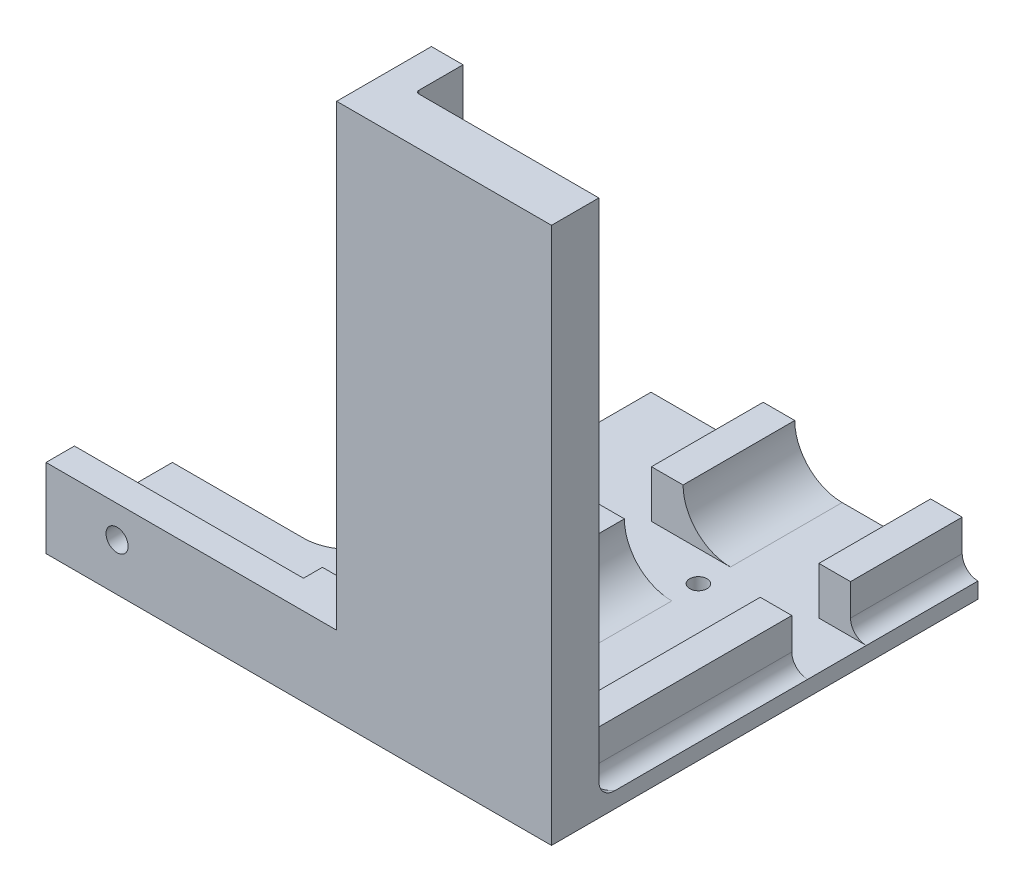
from build123d import *

# Parameters (mm, degrees)
BOSS_EXTRUDE1_DEPTH      = 250
BOSS_EXTRUDE2_DEPTH      = 50
BOSS_EXTRUDE2_2_DEPTH    = 50
LPATTERN1_COUNT          = 4
LPATTERN1_PITCH          = 60
SKETCH2_R                = 2.75
CUT_EXTRUDE1_DEPTH       = 251.864711302
UPPER_ACRYLIC_SUPP_W     = 20
UPPER_ACRYLIC_SUPP_H     = 250
BOSS_EXTRUDE3_DEPTH      = 5
UPPER_ACRYLIC_SUPP_3_W   = 10
UPPER_ACRYLIC_SUPP_3_H   = 66.073604859
UPPER_ACRYLIC_SUPP_3_H_2 = 41.475217291
UPPER_ACRYLIC_SUPP_3_H_3 = 42.557179481
UPPER_ACRYLIC_SUPP_3_H_4 = 45.558340935
BOSS_EXTRUDE4_DEPTH      = 15
FILLET1_R                = 15
SKETCH4_W                = 60
SKETCH4_H                = 15
BOSS_EXTRUDE5_DEPTH      = 5
SKETCH4_3_W              = 60
SKETCH4_3_H              = 15
BOSS_EXTRUDE6_DEPTH      = 60
SKETCH5_W                = 10
SKETCH5_H                = 45
BOSS_EXTRUDE7_DEPTH      = 15
BOSS_EXTRUDE8_START      = 250
SKETCH5_3_W              = 10
SKETCH5_3_H              = 45
BOSS_EXTRUDE8_DEPTH      = 15
FILLET2_R                = 1
SKETCH6_W                = 6
SKETCH6_H                = 60
CUT_EXTRUDE2_DEPTH       = 6
BOSS_EXTRUDE9_DEPTH      = 30
SKETCH8_W                = 333.602701612
SKETCH8_H                = 59.031331047
CUT_EXTRUDE3_DEPTH       = 150
SKETCH9_W                = 6
SKETCH9_H                = 20
CLOTH_ESCAPE_GAP_DEPTH   = 20
SKETCH11_W               = 9
SKETCH11_H               = 20
BOSS_EXTRUDE11_DEPTH     = 100
CUT_EXTRUDE4_DEPTH       = 68
SKETCH13_W               = 40
SKETCH13_H               = 5
BOSS_EXTRUDE13_DEPTH     = 100
CUT_EXTRUDE5_DEPTH       = 100
FILLET3_R                = 15
BOSS_EXTRUDE14_START     = -5
BOSS_EXTRUDE14_DEPTH     = 25
CUT_EXTRUDE6_DEPTH       = 30
CUT_EXTRUDE6_DEPTH_BACK  = 10
SKETCH16_5_W             = 8.5
SKETCH16_5_H             = 41.475217291
SKETCH16_5_H_2           = 42.557179481
SKETCH16_5_W_2           = 1.5
SKETCH16_5_H_3           = 42.177819043
SKETCH16_5_H_4           = 20.831100018
SKETCH16_5_H_5           = 17.311395043
SKETCH16_5_H_6           = 18.573684265
SKETCH16_5_H_7           = 65.073604859
SKETCH16_6_W             = 8.5
SKETCH16_6_H             = 41.475217291
SKETCH16_6_H_2           = 42.557179481
SKETCH16_6_W_2           = 1.5
SKETCH16_6_H_3           = 42.177819043
SKETCH16_6_H_4           = 20.831100018
SKETCH16_6_H_5           = 17.311395043
SKETCH16_6_H_6           = 18.573684265
SKETCH16_6_H_7           = 65.073604859
BOSS_EXTRUDE15_DEPTH     = 5
BOSS_EXTRUDE16_DEPTH     = 20
SKETCH16_8_W             = 8.5
SKETCH16_8_H             = 41.475217291
SKETCH16_8_H_2           = 42.557179481
SKETCH16_8_W_2           = 1.5
SKETCH16_8_H_3           = 42.177819043
SKETCH16_8_H_4           = 65.073604859
BOSS_EXTRUDE17_DEPTH     = 15
BOSS_EXTRUDE18_START     = -5
BOSS_EXTRUDE18_DEPTH     = 25
FILLET4_R                = 5
BOSS_EXTRUDE21_START     = 145
BOSS_EXTRUDE21_DEPTH     = 170
SKETCH19_R               = 3.5
CUT_EXTRUDE7_DEPTH       = 10
CUT_EXTRUDE8_DEPTH       = 355
CUT_EXTRUDE8_DEPTH_BACK  = 10
SKETCH20_R               = 3.5
SKETCH21_W               = 15
SKETCH21_H               = 197.501027769
CUT_EXTRUDE9_DEPTH       = 130
SKETCH22_W               = 160
SKETCH22_H               = 135
SKETCH22_H_2             = 10
CUT_EXTRUDE11_DEPTH      = 270


with BuildPart() as part:
    # profile → Boss-Extrude1 (new body)
    with BuildSketch(Plane.XY):
        Polygon((-14.746446609, 10.353553391), (-5.253553391, 10.353553391), (5.667330529, 10.353553391), (14.746446609, 10.353553391), (20, 10.353553391), (20, 15.353553391), (-20, 15.353553391), (-20, 10.353553391), align=None)
    extrude(amount=BOSS_EXTRUDE1_DEPTH)

    # Sketch2 → Cut-Extrude1 (cut, through all)
    with BuildSketch(Plane.XZ.offset(-10.353553391)):
        with Locations(Location((-10, 175, 0), (0, 0, 270))):
            Circle(SKETCH2_R)
        with Locations(Location((10, 175, 0), (0, 0, 270))):
            Circle(SKETCH2_R)
        with Locations(Location((-10, 115, 0), (0, 0, 270))):
            Circle(SKETCH2_R)
        with Locations(Location((10, 115, 0), (0, 0, 270))):
            Circle(SKETCH2_R)
        with Locations(Location((-10, 55, 0), (0, 0, 270))):
            Circle(SKETCH2_R)
        with Locations(Location((10, 55, 0), (0, 0, 270))):
            Circle(SKETCH2_R)
    extrude(amount=-CUT_EXTRUDE1_DEPTH, mode=Mode.SUBTRACT)

    # upper_acrylic_supp → Boss-Extrude3 (add)
    with BuildSketch(Plane(origin=(0, 15.353553391, 0), x_dir=(1, 0, 0), z_dir=(0, 1, 0))):
        with Locations((-30, -125)):
            Rectangle(UPPER_ACRYLIC_SUPP_W, UPPER_ACRYLIC_SUPP_H)
    extrude(amount=-BOSS_EXTRUDE3_DEPTH)

    # upper_acrylic_supp<3> → Boss-Extrude4 (add)
    with BuildSketch(Plane(origin=(0, 15.353553391, 0), x_dir=(1, 0, 0), z_dir=(0, 1, 0))):
        with Locations((-29.5, -216.963197571)):
            Rectangle(UPPER_ACRYLIC_SUPP_3_W, UPPER_ACRYLIC_SUPP_3_H)
        with Locations((-29.5, -144.615102231)):
            Rectangle(UPPER_ACRYLIC_SUPP_3_W, UPPER_ACRYLIC_SUPP_3_H_2)
        with Locations((-29.5, -85.287508801)):
            Rectangle(UPPER_ACRYLIC_SUPP_3_W, UPPER_ACRYLIC_SUPP_3_H_3)
        with Locations((-29.5, -22.779170468)):
            Rectangle(UPPER_ACRYLIC_SUPP_3_W, UPPER_ACRYLIC_SUPP_3_H_4)
    extrude(amount=BOSS_EXTRUDE4_DEPTH)

    # Fillet1
    fillet1_edges = [part.edges().sort_by_distance(p)[0] for p in [
        (-24.5, 15.353553391, 22.779170467),
        (-24.5, 15.353553391, 85.287508801),
        (-24.5, 15.353553391, 144.615102231),
        (-24.5, 15.353553391, 216.963197571),
    ]]
    fillet(fillet1_edges, radius=FILLET1_R - 0.0001)  # a hair under: the kernel refuses the full size



with BuildPart() as body_2:
    # Sketch1<3> → Boss-Extrude2 (new body)
    with BuildSketch(Plane.XY):
        Polygon((-7.253553391, 8.353553391), (-8.119669914, 7.487436867), (-5.5, 7.487436867), (-4.987436867, 7.487436867), (-5.5, 6.974873734), (-7.874873734, 4.6), (-12.125126266, 4.6), (-14.5, 6.974873734), (-15.012563133, 7.487436867), (-14.5, 7.487436867), (-11.880330086, 7.487436867), (-12.746446609, 8.353553391), (-14.746446609, 10.353553391), (-5.253553391, 10.353553391), align=None)
    boss_extrude2 = extrude(amount=BOSS_EXTRUDE2_DEPTH)


with BuildPart() as body_3:
    # Sketch1<3> → Boss-Extrude2 2 (new body)
    with BuildSketch(Plane.XY):
        Polygon((12.746446609, 8.353553391), (11.880330086, 7.487436867), (14.5, 7.487436867), (15.012563133, 7.487436867), (14.5, 6.974873734), (12.125126266, 4.6), (7.874873734, 4.6), (5.5, 6.974873734), (4.987436867, 7.487436867), (5.5, 7.487436867), (8.533447053, 7.487436867), (7.667330529, 8.353553391), (5.667330529, 10.353553391), (14.746446609, 10.353553391), align=None)
    boss_extrude2_2 = extrude(amount=BOSS_EXTRUDE2_2_DEPTH)


with BuildPart() as lpattern1_1:
    # LPattern1: pattern copy
    add(boss_extrude2.moved(Location(Vector(0, 0, 1) * (1 * LPATTERN1_PITCH))))


with BuildPart() as lpattern1_2:
    # LPattern1: pattern copy
    add(boss_extrude2.moved(Location(Vector(0, 0, 1) * (2 * LPATTERN1_PITCH))))


with BuildPart() as lpattern1_3:
    # LPattern1: pattern copy
    add(boss_extrude2.moved(Location(Vector(0, 0, 1) * (3 * LPATTERN1_PITCH))))


with BuildPart() as lpattern1_4:
    # LPattern1: pattern copy
    add(boss_extrude2_2.moved(Location(Vector(0, 0, 1) * (1 * LPATTERN1_PITCH))))


with BuildPart() as lpattern1_5:
    # LPattern1: pattern copy
    add(boss_extrude2_2.moved(Location(Vector(0, 0, 1) * (2 * LPATTERN1_PITCH))))


with BuildPart() as lpattern1_6:
    # LPattern1: pattern copy
    add(boss_extrude2_2.moved(Location(Vector(0, 0, 1) * (3 * LPATTERN1_PITCH))))


with BuildPart() as part_1:
    add(part.part)

    add(body_2.part)  # Boss-Extrude5 merges body 2

    add(body_3.part)  # Boss-Extrude5 merges body 3
    # Sketch4 → Boss-Extrude5 (add, symmetric)
    with BuildSketch(Plane(origin=(0, 15.353553391, 0), x_dir=(1, 0, 0), z_dir=(0, 1, 0))):
        with Locations((-10, -257.5)):
            Rectangle(SKETCH4_W, SKETCH4_H)
        with Locations((-10, 7.5)):
            Rectangle(SKETCH4_W, SKETCH4_H)
    extrude(amount=BOSS_EXTRUDE5_DEPTH, both=True)

    # Sketch4<3> → Boss-Extrude6 (add)
    with BuildSketch(Plane(origin=(0, 15.353553391, 0), x_dir=(1, 0, 0), z_dir=(0, 1, 0))):
        with Locations((-10, -257.5)):
            Rectangle(SKETCH4_3_W, SKETCH4_3_H)
        with Locations((-10, 7.5)):
            Rectangle(SKETCH4_3_W, SKETCH4_3_H)
    extrude(amount=BOSS_EXTRUDE6_DEPTH)

    # Sketch5 → Boss-Extrude7 (add)
    with BuildSketch(Plane(origin=(0, 0, 250), x_dir=(-1, 0, 0), z_dir=(0, 0, -1))):
        with Locations((29.5, 52.853553391)):
            Rectangle(SKETCH5_W, SKETCH5_H)
    extrude(amount=BOSS_EXTRUDE7_DEPTH)

    # Sketch5<3> → Boss-Extrude8 (add)
    with BuildSketch(Plane(origin=(0, 0, 250), x_dir=(-1, 0, 0), z_dir=(0, 0, -1)).offset(BOSS_EXTRUDE8_START)):
        with Locations((29.5, 52.853553391)):
            Rectangle(SKETCH5_3_W, SKETCH5_3_H)
    extrude(amount=-BOSS_EXTRUDE8_DEPTH)

    # Fillet2
    fillet2_edges = [part_1.edges().sort_by_distance(p)[0] for p in [
        (-24.5, 52.853503391, 250),
        (-24.5, 52.853503391, 0),
        (5.24995, 15.353553391, 250),
        (-20.106631007, 19.746922384, 250),
        (-20.106631007, 19.746922384, 0),
        (5.24995, 15.353553391, 0),
    ]]
    fillet(fillet2_edges, radius=FILLET2_R)

    # Sketch6 → Cut-Extrude2 (cut)
    with BuildSketch(Plane.ZY.offset(40)):
        with Locations((253, 45.353553391)):
            Rectangle(SKETCH6_W, SKETCH6_H)
        with Locations((-3, 45.353553391)):
            Rectangle(SKETCH6_W, SKETCH6_H)
    extrude(amount=-CUT_EXTRUDE2_DEPTH, mode=Mode.SUBTRACT)

    # Sketch7 → Boss-Extrude9 (add)
    with BuildSketch(Plane.ZY.offset(40)):
        Polygon((265, 75.353553391), (256, 75.353553391), (256, 15.353553391), (-6, 15.353553391), (-6, 75.353553391), (-15, 75.353553391), (-15, 10.353553391), (265, 10.353553391), align=None)
    extrude(amount=BOSS_EXTRUDE9_DEPTH)

    # Sketch8 → Cut-Extrude3 (cut)
    with BuildSketch(Plane.ZY.offset(70)):
        with Locations((122.426839416, 64.869218915)):
            Rectangle(SKETCH8_W, SKETCH8_H)
    extrude(amount=-CUT_EXTRUDE3_DEPTH, mode=Mode.SUBTRACT)

    # Sketch9 → cloth_escape_gap (add)
    with BuildSketch(Plane.ZY.offset(34)):
        with Locations((253, 25.353553391)):
            Rectangle(SKETCH9_W, SKETCH9_H)
        with Locations((-3, 25.353553391)):
            Rectangle(SKETCH9_W, SKETCH9_H)
    extrude(amount=CLOTH_ESCAPE_GAP_DEPTH)

    # Sketch11 → Boss-Extrude11 (add)
    with BuildSketch(Plane.ZY.offset(70)):
        with Locations((-10.5, 25.353553391)):
            Rectangle(SKETCH11_W, SKETCH11_H)
        with Locations((260.5, 25.353553391)):
            Rectangle(SKETCH11_W, SKETCH11_H)
    extrude(amount=BOSS_EXTRUDE11_DEPTH)

    # Sketch12 → Cut-Extrude4 (cut)
    with BuildSketch(Plane.XZ.offset(-10.353553391)):
        Polygon((-170, 265), (-70, 265), (-170, 260.5), align=None)
        Polygon((-70, -15), (-170, -10.5), (-170, -15), align=None)
    extrude(amount=-CUT_EXTRUDE4_DEPTH, mode=Mode.SUBTRACT)

    # Sketch13 → Boss-Extrude13 (add)
    with BuildSketch(Plane.ZY.offset(70)):
        with Locations((5, 12.853553391)):
            Rectangle(SKETCH13_W, SKETCH13_H)
        with Locations((245, 12.853553391)):
            Rectangle(SKETCH13_W, SKETCH13_H)
    extrude(amount=BOSS_EXTRUDE13_DEPTH)

    # Sketch14 → Cut-Extrude5 (cut)
    with BuildSketch(Plane(origin=(0, 15.353553391, 0), x_dir=(1, 0, 0), z_dir=(0, 1, 0))):
        Polygon((-70, -265), (-170, -260.5), (-170, -265), align=None)
        Polygon((-170, 15), (-170, 10.5), (-70, 15), align=None)
    extrude(amount=-CUT_EXTRUDE5_DEPTH, mode=Mode.SUBTRACT)

    # Fillet3
    fillet3_edges = [part_1.edges().sort_by_distance(p)[0] for p in [
        (-70, 12.853553391, 25),
        (-70, 12.853553391, 225),
    ]]
    fillet(fillet3_edges, radius=FILLET3_R)

    # Sketch16 → Boss-Extrude14 (add)
    with BuildSketch(Plane(origin=(0, 15.353553391, 0), x_dir=(1, 0, 0), z_dir=(0, 1, 0)).offset(BOSS_EXTRUDE14_START)):
        Polygon((28.5, 0), (33.5, 0), (33.5, 15), (18.5, 15), (18.5, 0), align=None)
        Polygon((18.5, -250), (18.5, -265), (33.5, -265), (33.5, -250), (28.5, -250), align=None)
    extrude(amount=BOSS_EXTRUDE14_DEPTH)

    # Sketch16<5> → Cut-Extrude6 (cut, two sides: drawn at the far end of the back side and taken through both)
    with BuildSketch(Plane(origin=(0, 15.353553391, 0), x_dir=(1, 0, 0), z_dir=(0, 1, 0)).offset(-CUT_EXTRUDE6_DEPTH_BACK)):
        Polygon((18.5, -250), (18.5, -265), (33.5, -265), (33.5, -250), (28.5, -250), align=None)
        Polygon((28.5, -250), (33.5, -250), (33.5, 0), (28.5, 0), (28.5, -43.177819043), (20, -43.177819043), (20, -64.008919061), (28.5, -64.008919061), (28.5, -106.566098542), (20, -106.566098542), (20, -123.877493585), (28.5, -123.877493585), (28.5, -165.352710876), (20, -165.352710876), (20, -183.926395141), (28.5, -183.926395141), align=None)
        with Locations((24.25, -144.615102231)):
            Rectangle(SKETCH16_5_W, SKETCH16_5_H)
        with Locations((24.25, -85.287508801)):
            Rectangle(SKETCH16_5_W, SKETCH16_5_H_2)
        Polygon((28.5, -43.177819043), (28.5, 0), (18.5, 0), (18.5, -1), (20, -1), (20, -43.177819043), align=None)
        Polygon((28.5, 0), (33.5, 0), (33.5, 15), (18.5, 15), (18.5, 0), align=None)
        with Locations((19.25, -22.088909521)):
            Rectangle(SKETCH16_5_W_2, SKETCH16_5_H_3)
        with Locations((19.25, -53.593369052)):
            Rectangle(SKETCH16_5_W_2, SKETCH16_5_H_4)
        with Locations((19.25, -85.287508801)):
            Rectangle(SKETCH16_5_W_2, SKETCH16_5_H_2)
        with Locations((19.25, -115.221796064)):
            Rectangle(SKETCH16_5_W_2, SKETCH16_5_H_5)
        with Locations((19.25, -144.615102231)):
            Rectangle(SKETCH16_5_W_2, SKETCH16_5_H)
        with Locations((19.25, -174.639553009)):
            Rectangle(SKETCH16_5_W_2, SKETCH16_5_H_6)
        with Locations((19.25, -216.463197571)):
            Rectangle(SKETCH16_5_W_2, SKETCH16_5_H_7)
        Polygon((18.5, -249), (18.5, -250), (28.5, -250), (28.5, -183.926395141), (20, -183.926395141), (20, -249), align=None)
    extrude(amount=CUT_EXTRUDE6_DEPTH + CUT_EXTRUDE6_DEPTH_BACK, mode=Mode.SUBTRACT)

    # Sketch16<6> → Boss-Extrude15 (add)
    with BuildSketch(Plane(origin=(0, 15.353553391, 0), x_dir=(1, 0, 0), z_dir=(0, 1, 0))):
        Polygon((28.5, -250), (33.5, -250), (33.5, 0), (28.5, 0), (28.5, -43.177819043), (20, -43.177819043), (20, -64.008919061), (28.5, -64.008919061), (28.5, -106.566098542), (20, -106.566098542), (20, -123.877493585), (28.5, -123.877493585), (28.5, -165.352710876), (20, -165.352710876), (20, -183.926395141), (28.5, -183.926395141), align=None)
        Polygon((18.5, -249), (18.5, -250), (28.5, -250), (28.5, -183.926395141), (20, -183.926395141), (20, -249), align=None)
        Polygon((18.5, -250), (18.5, -265), (33.5, -265), (33.5, -250), (28.5, -250), align=None)
        with Locations((24.25, -144.615102231)):
            Rectangle(SKETCH16_6_W, SKETCH16_6_H)
        with Locations((24.25, -85.287508801)):
            Rectangle(SKETCH16_6_W, SKETCH16_6_H_2)
        Polygon((28.5, -43.177819043), (28.5, 0), (18.5, 0), (18.5, -1), (20, -1), (20, -43.177819043), align=None)
        Polygon((28.5, 0), (33.5, 0), (33.5, 15), (18.5, 15), (18.5, 0), align=None)
        with Locations((19.25, -22.088909521)):
            Rectangle(SKETCH16_6_W_2, SKETCH16_6_H_3)
        with Locations((19.25, -53.593369052)):
            Rectangle(SKETCH16_6_W_2, SKETCH16_6_H_4)
        with Locations((19.25, -85.287508801)):
            Rectangle(SKETCH16_6_W_2, SKETCH16_6_H_2)
        with Locations((19.25, -115.221796064)):
            Rectangle(SKETCH16_6_W_2, SKETCH16_6_H_5)
        with Locations((19.25, -144.615102231)):
            Rectangle(SKETCH16_6_W_2, SKETCH16_6_H)
        with Locations((19.25, -174.639553009)):
            Rectangle(SKETCH16_6_W_2, SKETCH16_6_H_6)
        with Locations((19.25, -216.463197571)):
            Rectangle(SKETCH16_6_W_2, SKETCH16_6_H_7)
    extrude(amount=-BOSS_EXTRUDE15_DEPTH)

    # Sketch16<7> → Boss-Extrude16 (add)
    with BuildSketch(Plane(origin=(0, 15.353553391, 0), x_dir=(1, 0, 0), z_dir=(0, 1, 0))):
        Polygon((18.5, -250), (18.5, -265), (33.5, -265), (33.5, -250), (28.5, -250), align=None)
        Polygon((28.5, 0), (33.5, 0), (33.5, 15), (18.5, 15), (18.5, 0), align=None)
    extrude(amount=BOSS_EXTRUDE16_DEPTH)

    # Sketch16<8> → Boss-Extrude17 (add)
    with BuildSketch(Plane(origin=(0, 15.353553391, 0), x_dir=(1, 0, 0), z_dir=(0, 1, 0))):
        Polygon((18.5, -249), (18.5, -250), (28.5, -250), (28.5, -183.926395141), (20, -183.926395141), (20, -249), align=None)
        with Locations((24.25, -144.615102231)):
            Rectangle(SKETCH16_8_W, SKETCH16_8_H)
        with Locations((24.25, -85.287508801)):
            Rectangle(SKETCH16_8_W, SKETCH16_8_H_2)
        Polygon((28.5, -43.177819043), (28.5, 0), (18.5, 0), (18.5, -1), (20, -1), (20, -43.177819043), align=None)
        with Locations((19.25, -22.088909521)):
            Rectangle(SKETCH16_8_W_2, SKETCH16_8_H_3)
        with Locations((19.25, -85.287508801)):
            Rectangle(SKETCH16_8_W_2, SKETCH16_8_H_2)
        with Locations((19.25, -144.615102231)):
            Rectangle(SKETCH16_8_W_2, SKETCH16_8_H)
        with Locations((19.25, -216.463197571)):
            Rectangle(SKETCH16_8_W_2, SKETCH16_8_H_4)
    extrude(amount=BOSS_EXTRUDE17_DEPTH)

    # Sketch14<2> → Boss-Extrude18 (add)
    with BuildSketch(Plane(origin=(0, 15.353553391, 0), x_dir=(1, 0, 0), z_dir=(0, 1, 0)).offset(BOSS_EXTRUDE18_START)):
        Polygon((-70, -265), (-170, -260.5), (-170, -265), align=None)
        Polygon((-170, 15), (-170, 10.5), (-70, 15), align=None)
    extrude(amount=BOSS_EXTRUDE18_DEPTH)

    # Fillet4
    fillet4_edges = [part_1.edges().sort_by_distance(p)[0] for p in [
        (31, 15.353553391, 0),
        (28.5, 15.353553391, 21.588909521),
        (28.5, 15.353553391, 85.287508801),
        (28.5, 15.353553391, 144.615102231),
        (31, 15.353553391, 250),
        (28.5, 15.353553391, 216.963197571),
    ]]
    fillet(fillet4_edges, radius=FILLET4_R - 0.0001)  # a hair under: the kernel refuses the full size

    # Sketch18 → Boss-Extrude21 (add)
    with BuildSketch(Plane(origin=(0, 35.353553391, 0), x_dir=(1, 0, 0), z_dir=(0, 1, 0)).offset(BOSS_EXTRUDE21_START)):
        with BuildLine():
            Line((-34.5, -250), (-34.5, -265))
            Line((-34.5, -265), (33.5, -265))
            Line((33.5, -265), (33.5, -250))
            Line((33.5, -250), (-23.5, -250))
            ThreePointArc((-23.5, -250), (-24.207106781, -249.707106781), (-24.5, -249))
            Line((-24.5, -249), (-24.5, -235))
            Line((-24.5, -235), (-34.5, -235))
            Line((-34.5, -235), (-34.5, -250))
        make_face()
        with BuildLine():
            Line((-34.5, 15), (-34.5, 0))
            Line((-34.5, 0), (-34.5, -15))
            Line((-34.5, -15), (-24.5, -15))
            Line((-24.5, -15), (-24.5, -1))
            ThreePointArc((-24.5, -1), (-24.207106781, -0.292893219), (-23.5, 0))
            Line((-23.5, 0), (33.5, 0))
            Line((33.5, 0), (33.5, 15))
            Line((33.5, 15), (-34.5, 15))
        make_face()
    extrude(amount=-BOSS_EXTRUDE21_DEPTH)

    # Sketch19 → Cut-Extrude7 (cut)
    with BuildSketch(Plane(origin=(0, 15.353553391, 0), x_dir=(1, 0, 0), z_dir=(0, 1, 0))):
        with Locations(Location((-154, -9.5, 0), (0, 0, 270))):
            Circle(SKETCH19_R)
        with Locations(Location((-104, -9.5, 0), (0, 0, 270))):
            Circle(SKETCH19_R)
        with Locations(Location((-104, -240.5, 0), (0, 0, 270))):
            Circle(SKETCH19_R)
        with Locations(Location((-154, -240.5, 0), (0, 0, 270))):
            Circle(SKETCH19_R)
    extrude(amount=-CUT_EXTRUDE7_DEPTH, mode=Mode.SUBTRACT)

    # Sketch20 → Cut-Extrude8 (cut, two sides: drawn at the far end of the back side and taken through both)
    with BuildSketch(Plane(origin=(0, 0, 256), x_dir=(-1, 0, 0), z_dir=(0, 0, -1)).offset(-CUT_EXTRUDE8_DEPTH_BACK)):
        with Locations(Location((104, 25.353553391, 0), (0, 0, 180))):
            Circle(SKETCH20_R)
        with Locations(Location((154, 25.353553391, 0), (0, 0, 180))):
            Circle(SKETCH20_R)
    extrude(amount=CUT_EXTRUDE8_DEPTH + CUT_EXTRUDE8_DEPTH_BACK, mode=Mode.SUBTRACT)

    # Sketch21 → Cut-Extrude9 (cut)
    with BuildSketch(Plane.XY):
        with Locations((6, 114.104067276)):
            Rectangle(SKETCH21_W, SKETCH21_H)
    extrude(amount=-CUT_EXTRUDE9_DEPTH, mode=Mode.SUBTRACT)


with BuildPart() as cut_extrude11_tool:
    # Sketch22 → Cut-Extrude11 (new body)
    with BuildSketch(Plane(origin=(0, 0, 0), x_dir=(1, 0, 0), z_dir=(0, 1, 0))):
        with Locations((-46.5, -52.5)):
            Rectangle(SKETCH22_W, SKETCH22_H)
        with Locations((-46.5, -125)):
            Rectangle(SKETCH22_W, SKETCH22_H_2)
        Polygon((-126.5, 15), (-186.5, 15), (-186.5, -265), (-126.5, -265), (-126.5, -130), (-126.5, -120), align=None)
    extrude(amount=CUT_EXTRUDE11_DEPTH)


with BuildPart() as part_2:
    add(part_1.part)

    # Cut-Extrude11: cut by cut_extrude11_tool
    add(cut_extrude11_tool.part, mode=Mode.SUBTRACT)


with BuildPart() as lpattern1_1_1:
    add(lpattern1_1.part)

    # Cut-Extrude11: cut by cut_extrude11_tool
    add(cut_extrude11_tool.part, mode=Mode.SUBTRACT)


with BuildPart() as lpattern1_2_1:
    add(lpattern1_2.part)

    # Cut-Extrude11: cut by cut_extrude11_tool
    add(cut_extrude11_tool.part, mode=Mode.SUBTRACT)


with BuildPart() as lpattern1_4_1:
    add(lpattern1_4.part)

    # Cut-Extrude11: cut by cut_extrude11_tool
    add(cut_extrude11_tool.part, mode=Mode.SUBTRACT)


with BuildPart() as lpattern1_5_1:
    add(lpattern1_5.part)

    # Cut-Extrude11: cut by cut_extrude11_tool
    add(cut_extrude11_tool.part, mode=Mode.SUBTRACT)


solid = Compound([lpattern1_3.part, lpattern1_6.part, part_2.part, lpattern1_2_1.part, lpattern1_5_1.part])
